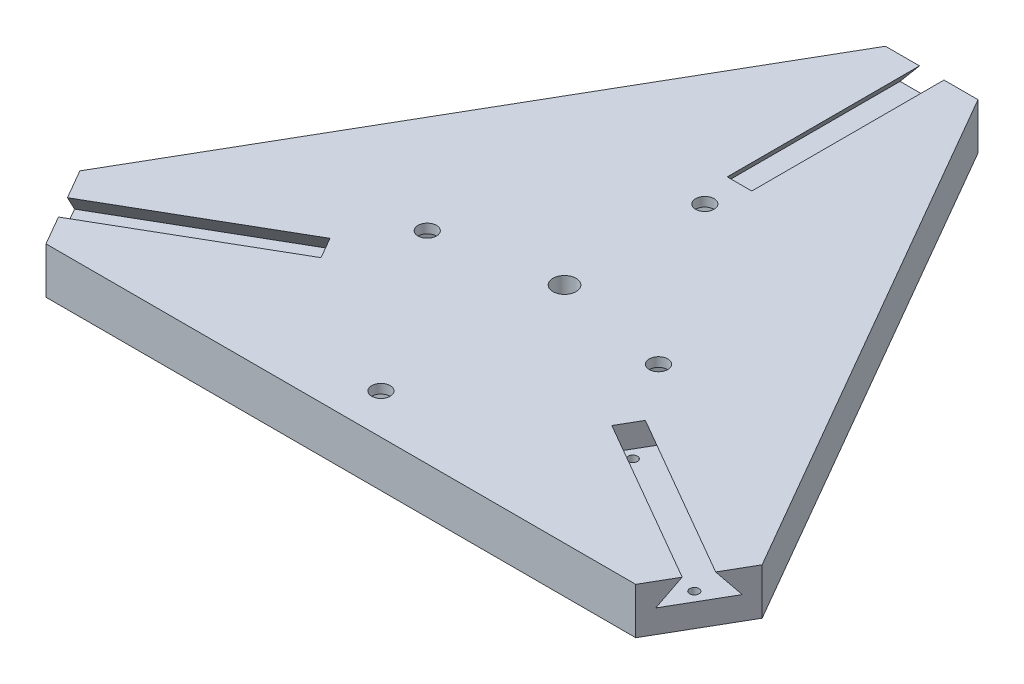
from build123d import *

# Parameters (mm, degrees)
ESQUISSE1_R                  = 2.5
BOSS_EXTRU_1_DEPTH           = 5
ESQUISSE2_R                  = 1
ENL_V_MAT_EXTRU_1_DEPTH      = 109.799753466
R_P_TITION_CIRCULAIRE1_COUNT = 3
ENL_V_MAT_EXTRU_2_DEPTH      = 41.553
R_P_TITION_CIRCULAIRE2_COUNT = 3
ESQUISSE4_R                  = 2
ENL_V_MAT_EXTRU_3_DEPTH      = 109.799753466
ESQUISSE5_W                  = 60.3
ESQUISSE5_H                  = 80.302539332
ESQUISSE5_W_2                = 39.7
ESQUISSE5_H_2                = 59.702539332
ENL_V_MAT_EXTRU_4_DEPTH      = 8
ESQUISSE6_R                  = 6.325
ESQUISSE6_R_2                = 3.325
BOSS_EXTRU_2_DEPTH           = 10


with BuildPart() as part:
    # Esquisse1 → Boss.-Extru.1 (new, symmetric)
    with BuildSketch(Plane(origin=(0, 0, 0), x_dir=(1, 0, 0), z_dir=(0, 1, 0))):
        Polygon((-10, 79.372539332), (10, 79.372539332), (73.738635424, -31.026015628), (63.738635424, -48.346523704), (-63.738635424, -48.346523704), (-73.738635424, -31.026015628), align=None)
        Circle(ESQUISSE1_R, mode=Mode.SUBTRACT)
    extrude(amount=BOSS_EXTRU_1_DEPTH, both=True)

    # Esquisse2 → Enlèv. mat.-Extru.1 (cut, through all)
    with BuildSketch(Plane(origin=(0, 5, 0), x_dir=(1, 0, 0), z_dir=(0, 1, 0))):
        with Locations((-66.357065564, -38.311269666)):
            Circle(ESQUISSE2_R)
        with Locations((-34.920343407, -20.161269666)):
            Circle(ESQUISSE2_R)
    enl_v_mat_extru_1 = extrude(amount=-ENL_V_MAT_EXTRU_1_DEPTH, mode=Mode.SUBTRACT)

    # Répétition circulaire1: Enlèv. mat.-Extru.1 ×3 about axis
    r_p_tition_circulaire1_axis = Axis((0, 5, 0), (0, -1, 0))
    for i in range(1, R_P_TITION_CIRCULAIRE1_COUNT):
        add(enl_v_mat_extru_1.rotate(r_p_tition_circulaire1_axis, i * 360 / R_P_TITION_CIRCULAIRE1_COUNT), mode=Mode.SUBTRACT)

    # Esquisse3 → Enlèv. mat.-Extru.2 (cut)
    with BuildSketch(Plane(origin=(68.738635424, 0, 39.686269666), x_dir=(0.5000000000000043, 0, -0.8660254037844363), z_dir=(0.8660254037844362, 0, 0.5000000000000042))):
        Polygon((2.65, 5), (6.845, 0), (-6.845, 0), (-2.65, 5), align=None)
    enl_v_mat_extru_2 = extrude(amount=-ENL_V_MAT_EXTRU_2_DEPTH, mode=Mode.SUBTRACT)

    # Répétition circulaire2: Enlèv. mat.-Extru.2 ×3 about axis
    r_p_tition_circulaire2_axis = Axis((0, 5, 0), (0, -1, 0))
    for i in range(1, R_P_TITION_CIRCULAIRE2_COUNT):
        add(enl_v_mat_extru_2.rotate(r_p_tition_circulaire2_axis, i * 360 / R_P_TITION_CIRCULAIRE2_COUNT), mode=Mode.SUBTRACT)

    # Esquisse4 → Enlèv. mat.-Extru.3 (cut, through all)
    with BuildSketch(Plane.XZ.offset(5)):
        with Locations((0, -30.322539332)):
            Circle(ESQUISSE4_R)
        with Locations((0, 39.68)):
            Circle(ESQUISSE4_R)
        with Locations((25, 4.68)):
            Circle(ESQUISSE4_R)
        with Locations((-25, 4.68)):
            Circle(ESQUISSE4_R)
    extrude(amount=-ENL_V_MAT_EXTRU_3_DEPTH, mode=Mode.SUBTRACT)

    # Esquisse5 → Enlèv. mat.-Extru.4 (cut)
    with BuildSketch(Plane.XZ.offset(5)):
        with Locations((0, 4.678730334)):
            Rectangle(ESQUISSE5_W, ESQUISSE5_H)
        with Locations((0, 4.678730334)):
            Rectangle(ESQUISSE5_W_2, ESQUISSE5_H_2, mode=Mode.SUBTRACT)
    extrude(amount=-ENL_V_MAT_EXTRU_4_DEPTH, mode=Mode.SUBTRACT)

    # Esquisse6 → Boss.-Extru.2 (add)
    with BuildSketch(Plane.XZ.offset(5)):
        with Locations((0, 20.18)):
            Circle(ESQUISSE6_R)
        with Locations((0, 20.18)):
            Circle(ESQUISSE6_R_2, mode=Mode.SUBTRACT)
    extrude(amount=BOSS_EXTRU_2_DEPTH)


solid = part.part
